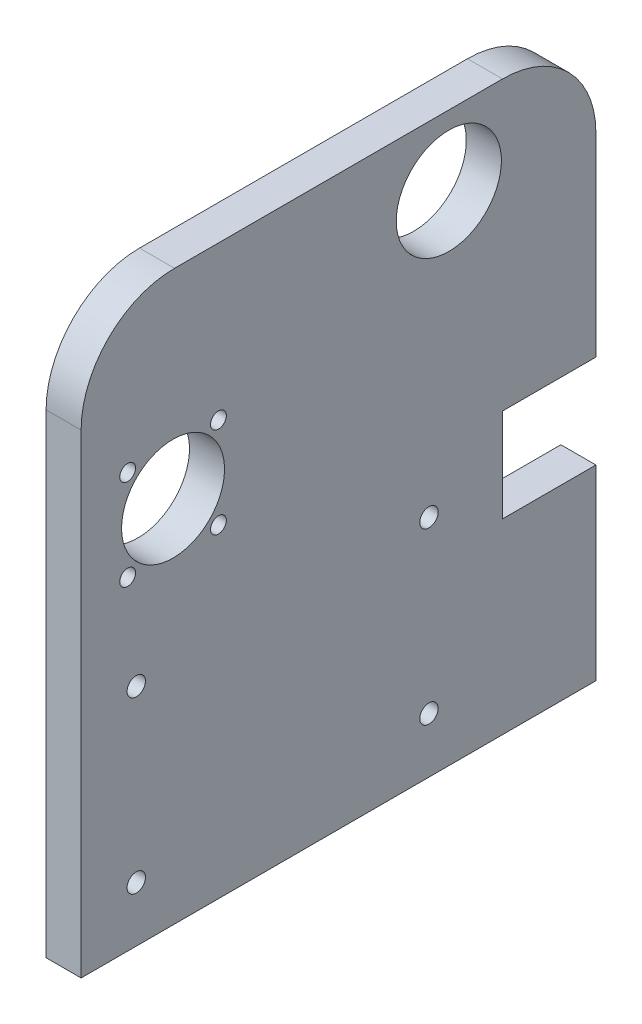
from build123d import *

# Parameters (mm, degrees)
SKETCH1_W             = 9.525
SKETCH1_H             = 140
BOSS_EXTRUDE1_DEPTH   = 77.221817616
FILLET1_R             = 25.4
SKETCH3_R             = 14.29
SKETCH3_R_2           = 2.15
SKETCH3_R_3           = 14
CUT_EXTRUDE2_DEPTH    = 28.575
SKETCH5_W             = 25.4
SKETCH5_H             = 25.4
CUT_EXTRUDE4_DEPTH    = 105.661046913
M6_TAPPED_HOLE1_D     = 5
M6_TAPPED_HOLE1_DEPTH = 10
M6_TAPPED_HOLE1_TIP   = 1.502151548
M6_TAPPED_HOLE2_D     = 5


with BuildPart() as part:
    # Sketch1 → Boss-Extrude1 (new, symmetric)
    with BuildSketch(Plane(origin=(0, 0, 0), x_dir=(1, 0, 0), z_dir=(0, 1, 0))):
        Rectangle(SKETCH1_W, SKETCH1_H)
    extrude(amount=BOSS_EXTRUDE1_DEPTH, both=True)

    # Fillet1
    fillet1_edges = [part.edges().sort_by_distance(p)[0] for p in [
        (0, 77.221817616, 70),
        (0, 77.221817616, -70),
    ]]
    fillet(fillet1_edges, radius=FILLET1_R)

    # Sketch3 → Cut-Extrude2 (cut)
    with BuildSketch(Plane.ZY.offset(4.7625)):
        with Locations((-30, 58.171817616)):
            Circle(SKETCH3_R)
        with Locations((32.652147834, 35.519669782)):
            Circle(SKETCH3_R_2)
        with Locations((57.347852166, 35.519669782)):
            Circle(SKETCH3_R_2)
        with Locations((32.652147834, 10.82396545)):
            Circle(SKETCH3_R_2)
        with Locations((57.347852166, 10.82396545)):
            Circle(SKETCH3_R_2)
        with Locations((45, 23.171817616)):
            Circle(SKETCH3_R_3)
    extrude(amount=-CUT_EXTRUDE2_DEPTH, mode=Mode.SUBTRACT)

    # Sketch5 → Cut-Extrude4 (cut, through all)
    with BuildSketch(Plane.ZY.offset(4.7625)):
        with Locations((-57.3, -13.696417616)):
            Rectangle(SKETCH5_W, SKETCH5_H)
    extrude(amount=-CUT_EXTRUDE4_DEPTH, mode=Mode.SUBTRACT)

    # M6 Tapped Hole1
    with Locations(Plane(origin=(0, 0, -44.6), x_dir=(-1, 0, 0), z_dir=(0, 0, -1))):
        with Locations((0, -13.696417616)):
            Hole(M6_TAPPED_HOLE1_D / 2, depth=M6_TAPPED_HOLE1_DEPTH)
            with Locations((0, 0, -(M6_TAPPED_HOLE1_DEPTH + M6_TAPPED_HOLE1_TIP / 2))):  # 118° drill point
                Cone(0, M6_TAPPED_HOLE1_D / 2, M6_TAPPED_HOLE1_TIP, mode=Mode.SUBTRACT)

    # M6 Tapped Hole2 (through all)
    with Locations(Plane.ZY.offset(4.7625)):
        with Locations((-24.6, -15.996417616), (55, -15.996417616), (-24.6, -62.221817616), (55, -62.221817616)):
            Hole(M6_TAPPED_HOLE2_D / 2)


solid = part.part
